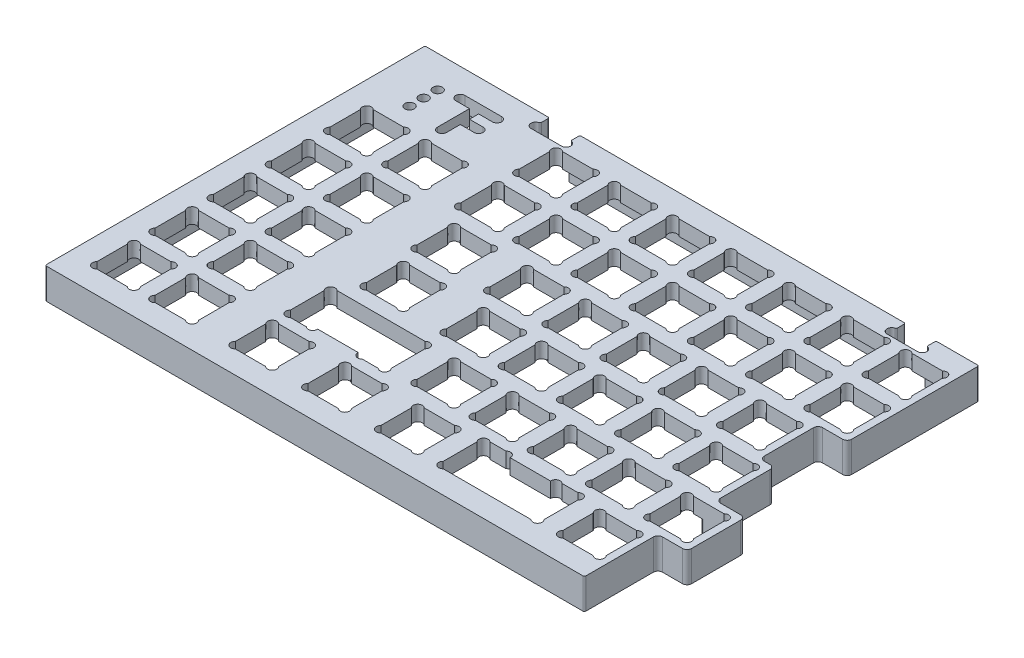
from build123d import *

# Parameters (mm, degrees)
PLATE_FRAME_DEPTH               = 5
CUT_EXTRUDE_1U_DEPTH            = 224.745817
LEFTSHIFT_REACH                 = 225.746
LEFTSPACE_DEPTH                 = 224.745817
LIP_DEPTH                       = 5
USB_SLOTS_DEPTH                 = 224.913355173
SKETCH12_R                      = 1.55
LOCKLEDS_DEPTH                  = 224.913355173
LOGO_DEPTH                      = 224.913355173
SKETCH16_R                      = 1.5
CUT_EXTRUDE10_DEPTH             = 224.745817
M2X0_4_TAPPED_HOLE1_D           = 1.6
M2X0_4_TAPPED_HOLE1_DEPTH       = 5.2
M2X0_4_TAPPED_HOLE1_CSINK_D     = 2.05
M2X0_4_TAPPED_HOLE1_CSINK_ANGLE = 90
M2X0_4_TAPPED_HOLE1_TIP         = 0.480688495
FILLET1_R                       = 1.5
FILLET2_R                       = 0.5


with BuildPart() as part:
    # Sketch1 → Plate Frame (new body)
    with BuildSketch(Plane(origin=(0, 0, 0), x_dir=(1, 0, 0), z_dir=(0, 1, 0))):
        Polygon((0, 0), (0, 124.3), (181.2125, 124.3), (181.2125, 81.2), (171.6875, 81.2), (171.6875, 62.15), (176.45, 62.15), (176.45, 43.1), (185.975, 43.1), (185.975, 24.05), (176.45, 24.05), (176.45, 0), align=None)
    extrude(amount=PLATE_FRAME_DEPTH)

    # Sketch2 → Cut-Extrude 1U (cut, through all)
    with BuildSketch(Plane(origin=(0, 5, 0), x_dir=(1, 0, 0), z_dir=(0, 1, 0))):
        with BuildLine():
            Line((7.425, 19.503679656), (7.425, 9.546320344))
            ThreePointArc((7.425, 9.546320344), (7.425, 7.425), (9.546320344, 7.425))
            Line((9.546320344, 7.425), (19.503679656, 7.425))
            ThreePointArc((19.503679656, 7.425), (21.625, 7.425), (21.625, 9.546320344))
            Line((21.625, 9.546320344), (21.625, 19.503679656))
            ThreePointArc((21.625, 19.503679656), (21.625, 21.625), (19.503679656, 21.625))
            Line((19.503679656, 21.625), (9.546320344, 21.625))
            ThreePointArc((9.546320344, 21.625), (7.425, 21.625), (7.425, 19.503679656))
        make_face()
    cut_extrude_1u = extrude(amount=-CUT_EXTRUDE_1U_DEPTH, mode=Mode.SUBTRACT)

    # Sketch-Pattern1: Cut-Extrude 1U at 44 more places
    with Locations((19.05, 0, 0), (19.05, 0, -19.05), (0, 0, -19.05), (0, 0, -38.1), (19.05, 0, -38.1), (19.05, 0, -57.15), (0, 0, -57.15), (0, 0, -76.2), (19.05, 0, -76.2), (42.8625, 0, -95.25), (42.8625, 0, -76.2), (61.9125, 0, -76.2), (61.9125, 0, -95.25), (80.9625, 0, -95.25), (80.9625, 0, -76.2), (100.0125, 0, -76.2), (100.0125, 0, -95.25), (119.0625, 0, -95.25), (119.0625, 0, -76.2), (138.1125, 0, -76.2), (138.1125, 0, -95.25), (157.1625, 0, -95.25), (157.1625, 0, -76.2), (71.4375, 0, -57.15), (47.625, 0, -57.15), (90.4875, 0, -57.15), (109.5375, 0, -57.15), (128.5875, 0, -57.15), (147.6375, 0, -57.15), (76.2, 0, -38.1), (95.25, 0, -38.1), (114.3, 0, -38.1), (133.35, 0, -38.1), (152.4, 0, -38.1), (85.725, 0, -19.05), (104.775, 0, -19.05), (123.825, 0, -19.05), (142.875, 0, -19.05), (161.925, 0, -19.05), (69.05625, 0, 0), (92.86875, 0, 0), (50.00625, 0, -38.1), (152.4, 0, 0), (45.24375, 0, 0)):
        add(cut_extrude_1u, mode=Mode.SUBTRACT)

    # Sketch14 → LeftShift (cut, up to next)
    with BuildSketch(Plane(origin=(0, 5, 0), x_dir=(1, 0, 0), z_dir=(0, 1, 0)), mode=Mode.PRIVATE) as leftshift_sk1:
        with BuildLine():
            Line((54.915070344, 40.625), (83.672429656, 40.625))
            ThreePointArc((83.672429656, 40.625), (85.79375, 40.625), (85.79375, 38.503679656))
            Line((85.79375, 38.503679656), (85.79375, 27.446320344))
            ThreePointArc((85.79375, 27.446320344), (85.79375, 25.325), (83.672429656, 25.325))
            Line((83.672429656, 25.325), (78.465070344, 25.325))
            ThreePointArc((78.465070344, 25.325), (76.766569569, 25.028030117), (75.910896057, 26.525))
            Line((75.910896057, 26.525), (62.676603943, 26.525))
            ThreePointArc((62.676603943, 26.525), (61.820930431, 25.028030117), (60.122429656, 25.325))
            Line((60.122429656, 25.325), (54.915070344, 25.325))
            ThreePointArc((54.915070344, 25.325), (52.79375, 25.325), (52.79375, 27.446320344))
            Line((52.79375, 27.446320344), (52.79375, 38.503679656))
            ThreePointArc((52.79375, 38.503679656), (52.79375, 40.625), (54.915070344, 40.625))
        make_face()
    leftshift_tool1 = extrude(leftshift_sk1.sketch, amount=-LEFTSHIFT_REACH, mode=Mode.PRIVATE) & part.part
    add(leftshift_tool1.solids().sort_by_distance((69.29375, 5, -33.184921))[0], mode=Mode.SUBTRACT)

    # Sketch7 → LeftSpace (cut, through all)
    with BuildSketch(Plane(origin=(0, 5, 0), x_dir=(1, 0, 0), z_dir=(0, 1, 0))):
        with BuildLine():
            Line((120.659375, 20.653679656), (120.659375, 9.596320344))
            ThreePointArc((120.659375, 9.596320344), (120.659375, 7.475), (122.780695344, 7.475))
            Line((122.780695344, 7.475), (151.538054656, 7.475))
            ThreePointArc((151.538054656, 7.475), (153.659375, 7.475), (153.659375, 9.596320344))
            Line((153.659375, 9.596320344), (153.659375, 20.653679656))
            ThreePointArc((153.659375, 20.653679656), (153.659375, 22.775), (151.538054656, 22.775))
            Line((151.538054656, 22.775), (146.330695344, 22.775))
            ThreePointArc((146.330695344, 22.775), (144.632194569, 23.071969883), (143.776521057, 21.575))
            Line((143.776521057, 21.575), (130.542228943, 21.575))
            ThreePointArc((130.542228943, 21.575), (129.686555431, 23.071969883), (127.988054656, 22.775))
            Line((127.988054656, 22.775), (122.780695344, 22.775))
            ThreePointArc((122.780695344, 22.775), (120.659375, 22.775), (120.659375, 20.653679656))
        make_face()
    extrude(amount=-LEFTSPACE_DEPTH, mode=Mode.SUBTRACT)

    # Sketch8 → Lip (add)
    with BuildSketch(Plane.XZ):
        Polygon((176.45, 0), (0, 0), (0, -124.3), (181.2125, -124.3), (181.2125, -81.2), (171.6875, -81.2), (171.6875, -62.15), (176.45, -62.15), (176.45, -43.1), (185.975, -43.1), (185.975, -24.05), (176.45, -24.05), align=None)
        Polygon((5, -5), (174.025, -5), (174.025, -26.475), (183.55, -26.475), (183.55, -40.675), (174.025, -40.675), (174.025, -59.725), (169.2625, -59.725), (169.2625, -83.625), (178.7875, -83.625), (178.7875, -119.3), (5, -119.3), align=None, mode=Mode.SUBTRACT)
    extrude(amount=LIP_DEPTH)

    # Sketch17 → USB-Slots (cut, through all)
    with BuildSketch(Plane(origin=(0, 5, 0), x_dir=(1, 0, 0), z_dir=(0, 1, 0))):
        with BuildLine():
            Line((40.6875, 121.275), (40.6875, 124.3))
            Line((40.6875, 124.3), (50.6875, 124.3))
            Line((50.6875, 124.3), (50.6875, 121.275))
            ThreePointArc((50.6875, 121.275), (52.1875, 119.775), (50.6875, 118.275))
            Line((50.6875, 118.275), (40.6875, 118.275))
            ThreePointArc((40.6875, 118.275), (39.1875, 119.775), (40.6875, 121.275))
        make_face()
        with BuildLine():
            Line((157.1875, 121.275), (157.1875, 124.3))
            Line((157.1875, 124.3), (167.1875, 124.3))
            Line((167.1875, 124.3), (167.1875, 121.275))
            ThreePointArc((167.1875, 121.275), (168.6875, 119.775), (167.1875, 118.275))
            Line((167.1875, 118.275), (157.1875, 118.275))
            ThreePointArc((157.1875, 118.275), (155.6875, 119.775), (157.1875, 121.275))
        make_face()
    extrude(amount=-USB_SLOTS_DEPTH, mode=Mode.SUBTRACT)

    # Sketch12 → LockLeds (cut, through all)
    with BuildSketch(Plane(origin=(0, 5, 0), x_dir=(1, 0, 0), z_dir=(0, 1, 0))):
        with Locations(Location((14.525, 113.925, 0), (0, 0, 270))):
            Circle(SKETCH12_R)
        with Locations(Location((14.525, 109.325, 0), (0, 0, 270))):
            Circle(SKETCH12_R)
        with Locations(Location((14.525, 104.725, 0), (0, 0, 270))):
            Circle(SKETCH12_R)
    extrude(amount=-LOCKLEDS_DEPTH, mode=Mode.SUBTRACT)

    # Sketch15 → Logo (cut, through all)
    with BuildSketch(Plane(origin=(0, 5, 0), x_dir=(1, 0, 0), z_dir=(0, 1, 0))):
        with BuildLine():
            Line((20.525, 116.825), (32.525, 116.825))
            ThreePointArc((32.525, 116.825), (34.025, 115.325), (32.525, 113.825))
            Line((32.525, 113.825), (20.525, 113.825))
            ThreePointArc((20.525, 113.825), (19.025, 115.325), (20.525, 116.825))
        make_face()
        with BuildLine():
            Line((28.025, 115.325), (28.025, 103.325))
            ThreePointArc((28.025, 103.325), (26.525, 101.825), (25.025, 103.325))
            Line((25.025, 103.325), (25.025, 115.325))
            ThreePointArc((25.025, 115.325), (26.525, 116.825), (28.025, 115.325))
        make_face()
        with BuildLine():
            Line((26.525, 110.825), (32.525, 110.825))
            ThreePointArc((32.525, 110.825), (34.025, 109.325), (32.525, 107.825))
            Line((32.525, 107.825), (26.525, 107.825))
            ThreePointArc((26.525, 107.825), (25.025, 109.325), (26.525, 110.825))
        make_face()
    extrude(amount=-LOGO_DEPTH, mode=Mode.SUBTRACT)

    # Sketch16 → Cut-Extrude10 (cut, through all)
    with BuildSketch(Plane(origin=(0, 0, 0), x_dir=(1, 0, 0), z_dir=(0, 1, 0))):
        with Locations((177.726839828, 115.814339828)):
            Circle(SKETCH16_R)
        with Locations((177.726839828, 103.735660172)):
            Circle(SKETCH16_R)
        with Locations((177.726839828, 96.764339828)):
            Circle(SKETCH16_R)
        with Locations((177.726839828, 84.685660172)):
            Circle(SKETCH16_R)
        with Locations((168.201839828, 77.714339828)):
            Circle(SKETCH16_R)
        with Locations((168.201839828, 65.635660172)):
            Circle(SKETCH16_R)
        with Locations((172.964339828, 58.664339828)):
            Circle(SKETCH16_R)
        with Locations((172.964339828, 46.585660172)):
            Circle(SKETCH16_R)
        with Locations((182.489339828, 39.614339828)):
            Circle(SKETCH16_R)
        with Locations((182.489339828, 27.535660172)):
            Circle(SKETCH16_R)
        with Locations((172.964339828, 20.564339828)):
            Circle(SKETCH16_R)
        with Locations((172.964339828, 8.485660172)):
            Circle(SKETCH16_R)
    extrude(amount=-CUT_EXTRUDE10_DEPTH, mode=Mode.SUBTRACT)

    # M2x0.4 Tapped Hole1
    with Locations(Plane(origin=(0, -5, 0), x_dir=(-1, 0, 0), z_dir=(0, -1, 0))):
        with Locations((-178.7125, 121.8), (-103.7125, 121.8), (-2.5, 121.8), (-2.5, 62.15), (-2.5, 2.5), (-88.225, 2.5), (-173.95, 2.5)):
            CounterSinkHole(M2X0_4_TAPPED_HOLE1_D / 2, M2X0_4_TAPPED_HOLE1_CSINK_D / 2, depth=M2X0_4_TAPPED_HOLE1_DEPTH, counter_sink_angle=M2X0_4_TAPPED_HOLE1_CSINK_ANGLE)
            with Locations((0, 0, -(M2X0_4_TAPPED_HOLE1_DEPTH + M2X0_4_TAPPED_HOLE1_TIP / 2))):  # 118° drill point
                Cone(0, M2X0_4_TAPPED_HOLE1_D / 2, M2X0_4_TAPPED_HOLE1_TIP, mode=Mode.SUBTRACT)

    # Fillet1
    fillet1_edges = [part.edges().sort_by_distance(p)[0] for p in [
        (5, -2.5, -119.3),
        (178.7875, -2.5, -119.3),
        (174.025, -2.5, -5),
        (5, -2.5, -5),
        (181.2125, 0, -81.2),
        (171.6875, 0, -81.2),
        (171.6875, 0, -62.15),
        (176.45, 0, -62.15),
        (176.45, 0, -43.1),
        (185.975, 0, -43.1),
        (185.975, 0, -24.05),
        (176.45, 0, -24.05),
    ]]
    fillet(fillet1_edges, radius=FILLET1_R)

    # Fillet2
    fillet2_edges = [part.edges().sort_by_distance(p)[0] for p in [
        (169.2625, -2.5, -83.625),
        (169.2625, -2.5, -59.725),
        (174.025, -2.5, -40.675),
        (174.025, -2.5, -26.475),
        (40.6875, 0, -124.3),
        (50.6875, 0, -124.3),
        (50.6875, 0, -121.275),
        (40.6875, 0, -121.275),
        (157.1875, 0, -124.3),
        (167.1875, 0, -124.3),
        (167.1875, 0, -121.275),
        (157.1875, 0, -121.275),
        (0, 0, 0),
        (0, 0, -124.3),
        (181.2125, 0, -124.3),
        (176.45, 0, 0),
    ]]
    fillet(fillet2_edges, radius=FILLET2_R)


solid = part.part
